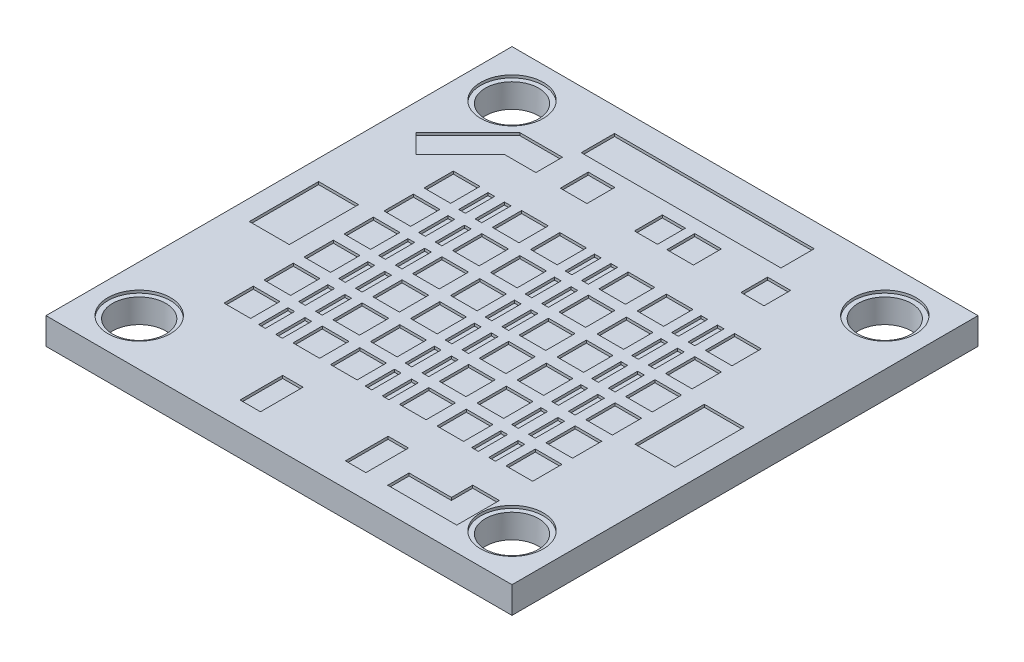
from build123d import *

# Parameters (mm, degrees)
SKETCH1_W          = 35
SKETCH1_H          = 35
SKETCH1_R          = 2
BASE_FLANGE2_DEPTH = 2
SKETCH2_W          = 15
SKETCH2_H          = 2.5
SKETCH2_W_2        = 2
SKETCH2_H_2        = 2.096279763
SKETCH2_H_3        = 2.2
SKETCH2_W_3        = 0.5
SKETCH2_W_4        = 1.534105798
SKETCH2_H_4        = 3.2
SKETCH2_W_5        = 3
SKETCH2_H_5        = 5.199999931
SKETCH2_W_6        = 1.731882906
SKETCH2_H_6        = 2
SKETCH2_R          = 2.35
SKETCH2_R_2        = 2
CUT_EXTRUDE1_DEPTH = 0.2


# Sheet-metal steps are written as plain solids
with BuildPart() as part:
    # Sketch1 → Base-Flange2 (new body)
    with BuildSketch(Plane(origin=(0, 0, 0), x_dir=(1, 0, 0), z_dir=(0, 1, 0))):
        Rectangle(SKETCH1_W, SKETCH1_H)
        with Locations(Location((-14, -14, 0), (0, 0, 270))):
            Circle(SKETCH1_R, mode=Mode.SUBTRACT)
        with Locations(Location((14, -14, 0), (0, 0, 90))):
            Circle(SKETCH1_R, mode=Mode.SUBTRACT)
        with Locations(Location((14, 14, 0), (0, 0, 270))):
            Circle(SKETCH1_R, mode=Mode.SUBTRACT)
        with Locations(Location((-14, 14, 0), (0, 0, 90))):
            Circle(SKETCH1_R, mode=Mode.SUBTRACT)
    extrude(amount=-BASE_FLANGE2_DEPTH)

    # Sketch2 → Cut-Extrude1 (cut)
    # profile 1 of 87: a face of its own
    with BuildSketch(Plane(origin=(0, 0, 0), x_dir=(1, 0, 0), z_dir=(0, 1, 0))):
        with Locations((-0.5, 14.45)):
            Rectangle(SKETCH2_W, SKETCH2_H)
    # profile 2 of 87: a face of its own
    with BuildSketch(Plane(origin=(0, 0, 0), x_dir=(1, 0, 0), z_dir=(0, 1, 0))):
        with Locations((-5.47579291, 11.151860119)):
            Rectangle(SKETCH2_W_2, SKETCH2_H_2)
    # profile 3 of 87: a face of its own
    with BuildSketch(Plane(origin=(0, 0, 0), x_dir=(1, 0, 0), z_dir=(0, 1, 0))):
        with Locations((-2.607675816, 6.1)):
            Rectangle(SKETCH2_W_2, SKETCH2_H_3)
    # profile 4 of 87: a face of its own
    with BuildSketch(Plane(origin=(0, 0, 0), x_dir=(1, 0, 0), z_dir=(0, 1, 0))):
        with Locations((-10.607675816, 6.1)):
            Rectangle(SKETCH2_W_2, SKETCH2_H_3)
    # profile 5 of 87: a face of its own
    with BuildSketch(Plane(origin=(0, 0, 0), x_dir=(1, 0, 0), z_dir=(0, 1, 0))):
        with Locations((-8.657675816, 6.003720444)):
            Rectangle(SKETCH2_W_3, SKETCH2_H_3)
    # profile 6 of 87: a face of its own
    with BuildSketch(Plane(origin=(0, 0, 0), x_dir=(1, 0, 0), z_dir=(0, 1, 0))):
        with Locations((-0.657675816, 6.003720444)):
            Rectangle(SKETCH2_W_3, SKETCH2_H_3)
    # profile 7 of 87: a face of its own
    with BuildSketch(Plane(origin=(0, 0, 0), x_dir=(1, 0, 0), z_dir=(0, 1, 0))):
        with Locations((5.392324184, 6.1)):
            Rectangle(SKETCH2_W_2, SKETCH2_H_3)
    # profile 8 of 87: a face of its own
    with BuildSketch(Plane(origin=(0, 0, 0), x_dir=(1, 0, 0), z_dir=(0, 1, 0))):
        with Locations((7.342324184, 6.003720444)):
            Rectangle(SKETCH2_W_3, SKETCH2_H_3)
    # profile 9 of 87: a face of its own
    with BuildSketch(Plane(origin=(0, 0, 0), x_dir=(1, 0, 0), z_dir=(0, 1, 0))):
        with Locations((-2.612819574, 3.100000069)):
            Rectangle(SKETCH2_W_2, SKETCH2_H_3)
    # profile 10 of 87: a face of its own
    with BuildSketch(Plane(origin=(0, 0, 0), x_dir=(1, 0, 0), z_dir=(0, 1, 0))):
        with Locations((-0.662819574, 3.003720513)):
            Rectangle(SKETCH2_W_3, SKETCH2_H_3)
    # profile 11 of 87: a face of its own
    with BuildSketch(Plane(origin=(0, 0, 0), x_dir=(1, 0, 0), z_dir=(0, 1, 0))):
        with Locations((5.387180426, 3.100000069)):
            Rectangle(SKETCH2_W_2, SKETCH2_H_3)
    # profile 12 of 87: a face of its own
    with BuildSketch(Plane(origin=(0, 0, 0), x_dir=(1, 0, 0), z_dir=(0, 1, 0))):
        with Locations((7.337180426, 3.003720513)):
            Rectangle(SKETCH2_W_3, SKETCH2_H_3)
    # profile 13 of 87: a face of its own
    with BuildSketch(Plane(origin=(0, 0, 0), x_dir=(1, 0, 0), z_dir=(0, 1, 0))):
        with Locations((-2.617963333, 0.100000138)):
            Rectangle(SKETCH2_W_2, SKETCH2_H_3)
    # profile 14 of 87: a face of its own
    with BuildSketch(Plane(origin=(0, 0, 0), x_dir=(1, 0, 0), z_dir=(0, 1, 0))):
        with Locations((-0.667963333, 0.003720582)):
            Rectangle(SKETCH2_W_3, SKETCH2_H_3)
    # profile 15 of 87: a face of its own
    with BuildSketch(Plane(origin=(0, 0, 0), x_dir=(1, 0, 0), z_dir=(0, 1, 0))):
        with Locations((5.382036667, 0.100000138)):
            Rectangle(SKETCH2_W_2, SKETCH2_H_3)
    # profile 16 of 87: a face of its own
    with BuildSketch(Plane(origin=(0, 0, 0), x_dir=(1, 0, 0), z_dir=(0, 1, 0))):
        with Locations((7.332036667, 0.003720582)):
            Rectangle(SKETCH2_W_3, SKETCH2_H_3)
    # profile 17 of 87: a face of its own
    with BuildSketch(Plane(origin=(0, 0, 0), x_dir=(1, 0, 0), z_dir=(0, 1, 0))):
        with Locations((-2.623107091, -2.899999793)):
            Rectangle(SKETCH2_W_2, SKETCH2_H_3)
    # profile 18 of 87: a face of its own
    with BuildSketch(Plane(origin=(0, 0, 0), x_dir=(1, 0, 0), z_dir=(0, 1, 0))):
        with Locations((-0.673107091, -2.996279349)):
            Rectangle(SKETCH2_W_3, SKETCH2_H_3)
    # profile 19 of 87: a face of its own
    with BuildSketch(Plane(origin=(0, 0, 0), x_dir=(1, 0, 0), z_dir=(0, 1, 0))):
        with Locations((5.376892909, -2.899999793)):
            Rectangle(SKETCH2_W_2, SKETCH2_H_3)
    # profile 20 of 87: a face of its own
    with BuildSketch(Plane(origin=(0, 0, 0), x_dir=(1, 0, 0), z_dir=(0, 1, 0))):
        with Locations((7.326892909, -2.996279349)):
            Rectangle(SKETCH2_W_3, SKETCH2_H_3)
    # profile 21 of 87: a face of its own
    with BuildSketch(Plane(origin=(0, 0, 0), x_dir=(1, 0, 0), z_dir=(0, 1, 0))):
        with Locations((-2.628250849, -5.899999724)):
            Rectangle(SKETCH2_W_2, SKETCH2_H_3)
    # profile 22 of 87: a face of its own
    with BuildSketch(Plane(origin=(0, 0, 0), x_dir=(1, 0, 0), z_dir=(0, 1, 0))):
        with Locations((-0.678250849, -5.99627928)):
            Rectangle(SKETCH2_W_3, SKETCH2_H_3)
    # profile 23 of 87: a face of its own
    with BuildSketch(Plane(origin=(0, 0, 0), x_dir=(1, 0, 0), z_dir=(0, 1, 0))):
        with Locations((5.371749151, -5.899999724)):
            Rectangle(SKETCH2_W_2, SKETCH2_H_3)
    # profile 24 of 87: a face of its own
    with BuildSketch(Plane(origin=(0, 0, 0), x_dir=(1, 0, 0), z_dir=(0, 1, 0))):
        with Locations((7.321749151, -5.99627928)):
            Rectangle(SKETCH2_W_3, SKETCH2_H_3)
    # profile 25 of 87: a face of its own
    with BuildSketch(Plane(origin=(0, 0, 0), x_dir=(1, 0, 0), z_dir=(0, 1, 0))):
        with Locations((-2.633394608, -8.899999656)):
            Rectangle(SKETCH2_W_2, SKETCH2_H_3)
    # profile 26 of 87: a face of its own
    with BuildSketch(Plane(origin=(0, 0, 0), x_dir=(1, 0, 0), z_dir=(0, 1, 0))):
        with Locations((-0.683394608, -8.996279212)):
            Rectangle(SKETCH2_W_3, SKETCH2_H_3)
    # profile 27 of 87: a face of its own
    with BuildSketch(Plane(origin=(0, 0, 0), x_dir=(1, 0, 0), z_dir=(0, 1, 0))):
        with Locations((5.366605392, -8.899999656)):
            Rectangle(SKETCH2_W_2, SKETCH2_H_3)
    # profile 28 of 87: a face of its own
    with BuildSketch(Plane(origin=(0, 0, 0), x_dir=(1, 0, 0), z_dir=(0, 1, 0))):
        with Locations((7.316605392, -8.996279212)):
            Rectangle(SKETCH2_W_3, SKETCH2_H_3)
    # profile 29 of 87: a face of its own
    with BuildSketch(Plane(origin=(0, 0, 0), x_dir=(1, 0, 0), z_dir=(0, 1, 0))):
        with Locations((-10.612819574, 3.100000069)):
            Rectangle(SKETCH2_W_2, SKETCH2_H_3)
    # profile 30 of 87: a face of its own
    with BuildSketch(Plane(origin=(0, 0, 0), x_dir=(1, 0, 0), z_dir=(0, 1, 0))):
        with Locations((-8.662819574, 3.003720513)):
            Rectangle(SKETCH2_W_3, SKETCH2_H_3)
    # profile 31 of 87: a face of its own
    with BuildSketch(Plane(origin=(0, 0, 0), x_dir=(1, 0, 0), z_dir=(0, 1, 0))):
        with Locations((-10.617963333, 0.100000138)):
            Rectangle(SKETCH2_W_2, SKETCH2_H_3)
    # profile 32 of 87: a face of its own
    with BuildSketch(Plane(origin=(0, 0, 0), x_dir=(1, 0, 0), z_dir=(0, 1, 0))):
        with Locations((-8.667963333, 0.003720582)):
            Rectangle(SKETCH2_W_3, SKETCH2_H_3)
    # profile 33 of 87: a face of its own
    with BuildSketch(Plane(origin=(0, 0, 0), x_dir=(1, 0, 0), z_dir=(0, 1, 0))):
        with Locations((-10.623107091, -2.899999793)):
            Rectangle(SKETCH2_W_2, SKETCH2_H_3)
    # profile 34 of 87: a face of its own
    with BuildSketch(Plane(origin=(0, 0, 0), x_dir=(1, 0, 0), z_dir=(0, 1, 0))):
        with Locations((-8.673107091, -2.996279349)):
            Rectangle(SKETCH2_W_3, SKETCH2_H_3)
    # profile 35 of 87: a face of its own
    with BuildSketch(Plane(origin=(0, 0, 0), x_dir=(1, 0, 0), z_dir=(0, 1, 0))):
        with Locations((-10.628250849, -5.899999724)):
            Rectangle(SKETCH2_W_2, SKETCH2_H_3)
    # profile 36 of 87: a face of its own
    with BuildSketch(Plane(origin=(0, 0, 0), x_dir=(1, 0, 0), z_dir=(0, 1, 0))):
        with Locations((-8.678250849, -5.99627928)):
            Rectangle(SKETCH2_W_3, SKETCH2_H_3)
    # profile 37 of 87: a face of its own
    with BuildSketch(Plane(origin=(0, 0, 0), x_dir=(1, 0, 0), z_dir=(0, 1, 0))):
        with Locations((-10.633394608, -8.899999656)):
            Rectangle(SKETCH2_W_2, SKETCH2_H_3)
    # profile 38 of 87: a face of its own
    with BuildSketch(Plane(origin=(0, 0, 0), x_dir=(1, 0, 0), z_dir=(0, 1, 0))):
        with Locations((-8.683394608, -8.996279212)):
            Rectangle(SKETCH2_W_3, SKETCH2_H_3)
    # profile 39 of 87: a face of its own
    with BuildSketch(Plane(origin=(0, 0, 0), x_dir=(1, 0, 0), z_dir=(0, 1, 0))):
        with Locations((-7.400074118, -8.996279212)):
            Rectangle(SKETCH2_W_3, SKETCH2_H_3)
    # profile 40 of 87: a face of its own
    with BuildSketch(Plane(origin=(0, 0, 0), x_dir=(1, 0, 0), z_dir=(0, 1, 0))):
        with Locations((-5.450074118, -8.899999656)):
            Rectangle(SKETCH2_W_2, SKETCH2_H_3)
    # profile 41 of 87: a face of its own
    with BuildSketch(Plane(origin=(0, 0, 0), x_dir=(1, 0, 0), z_dir=(0, 1, 0))):
        with Locations((-7.405217877, -5.99627928)):
            Rectangle(SKETCH2_W_3, SKETCH2_H_3)
    # profile 42 of 87: a face of its own
    with BuildSketch(Plane(origin=(0, 0, 0), x_dir=(1, 0, 0), z_dir=(0, 1, 0))):
        with Locations((-5.455217877, -5.899999724)):
            Rectangle(SKETCH2_W_2, SKETCH2_H_3)
    # profile 43 of 87: a face of its own
    with BuildSketch(Plane(origin=(0, 0, 0), x_dir=(1, 0, 0), z_dir=(0, 1, 0))):
        with Locations((-7.410361635, -2.996279349)):
            Rectangle(SKETCH2_W_3, SKETCH2_H_3)
    # profile 44 of 87: a face of its own
    with BuildSketch(Plane(origin=(0, 0, 0), x_dir=(1, 0, 0), z_dir=(0, 1, 0))):
        with Locations((-5.460361635, -2.899999793)):
            Rectangle(SKETCH2_W_2, SKETCH2_H_3)
    # profile 45 of 87: a face of its own
    with BuildSketch(Plane(origin=(0, 0, 0), x_dir=(1, 0, 0), z_dir=(0, 1, 0))):
        with Locations((-7.415505394, 0.003720582)):
            Rectangle(SKETCH2_W_3, SKETCH2_H_3)
    # profile 46 of 87: a face of its own
    with BuildSketch(Plane(origin=(0, 0, 0), x_dir=(1, 0, 0), z_dir=(0, 1, 0))):
        with Locations((-5.465505394, 0.100000138)):
            Rectangle(SKETCH2_W_2, SKETCH2_H_3)
    # profile 47 of 87: a face of its own
    with BuildSketch(Plane(origin=(0, 0, 0), x_dir=(1, 0, 0), z_dir=(0, 1, 0))):
        with Locations((-7.420649152, 3.003720513)):
            Rectangle(SKETCH2_W_3, SKETCH2_H_3)
    # profile 48 of 87: a face of its own
    with BuildSketch(Plane(origin=(0, 0, 0), x_dir=(1, 0, 0), z_dir=(0, 1, 0))):
        with Locations((-5.470649152, 3.100000069)):
            Rectangle(SKETCH2_W_2, SKETCH2_H_3)
    # profile 49 of 87: a face of its own
    with BuildSketch(Plane(origin=(0, 0, 0), x_dir=(1, 0, 0), z_dir=(0, 1, 0))):
        with Locations((-7.42579291, 6.003720444)):
            Rectangle(SKETCH2_W_3, SKETCH2_H_3)
    # profile 50 of 87: a face of its own
    with BuildSketch(Plane(origin=(0, 0, 0), x_dir=(1, 0, 0), z_dir=(0, 1, 0))):
        with Locations((-5.47579291, 6.1)):
            Rectangle(SKETCH2_W_2, SKETCH2_H_3)
    # profile 51 of 87: a face of its own
    with BuildSketch(Plane(origin=(0, 0, 0), x_dir=(1, 0, 0), z_dir=(0, 1, 0))):
        with Locations((2.52420709, 6.1)):
            Rectangle(SKETCH2_W_2, SKETCH2_H_3)
    # profile 52 of 87: a face of its own
    with BuildSketch(Plane(origin=(0, 0, 0), x_dir=(1, 0, 0), z_dir=(0, 1, 0))):
        with Locations((0.57420709, 6.003720444)):
            Rectangle(SKETCH2_W_3, SKETCH2_H_3)
    # profile 53 of 87: a face of its own
    with BuildSketch(Plane(origin=(0, 0, 0), x_dir=(1, 0, 0), z_dir=(0, 1, 0))):
        with Locations((2.529350848, 3.100000069)):
            Rectangle(SKETCH2_W_2, SKETCH2_H_3)
    # profile 54 of 87: a face of its own
    with BuildSketch(Plane(origin=(0, 0, 0), x_dir=(1, 0, 0), z_dir=(0, 1, 0))):
        with Locations((0.579350848, 3.003720513)):
            Rectangle(SKETCH2_W_3, SKETCH2_H_3)
    # profile 55 of 87: a face of its own
    with BuildSketch(Plane(origin=(0, 0, 0), x_dir=(1, 0, 0), z_dir=(0, 1, 0))):
        with Locations((2.534494606, 0.100000138)):
            Rectangle(SKETCH2_W_2, SKETCH2_H_3)
    # profile 56 of 87: a face of its own
    with BuildSketch(Plane(origin=(0, 0, 0), x_dir=(1, 0, 0), z_dir=(0, 1, 0))):
        with Locations((0.584494606, 0.003720582)):
            Rectangle(SKETCH2_W_3, SKETCH2_H_3)
    # profile 57 of 87: a face of its own
    with BuildSketch(Plane(origin=(0, 0, 0), x_dir=(1, 0, 0), z_dir=(0, 1, 0))):
        with Locations((2.539638365, -2.899999793)):
            Rectangle(SKETCH2_W_2, SKETCH2_H_3)
    # profile 58 of 87: a face of its own
    with BuildSketch(Plane(origin=(0, 0, 0), x_dir=(1, 0, 0), z_dir=(0, 1, 0))):
        with Locations((0.589638365, -2.996279349)):
            Rectangle(SKETCH2_W_3, SKETCH2_H_3)
    # profile 59 of 87: a face of its own
    with BuildSketch(Plane(origin=(0, 0, 0), x_dir=(1, 0, 0), z_dir=(0, 1, 0))):
        with Locations((2.544782123, -5.899999724)):
            Rectangle(SKETCH2_W_2, SKETCH2_H_3)
    # profile 60 of 87: a face of its own
    with BuildSketch(Plane(origin=(0, 0, 0), x_dir=(1, 0, 0), z_dir=(0, 1, 0))):
        with Locations((0.594782123, -5.99627928)):
            Rectangle(SKETCH2_W_3, SKETCH2_H_3)
    # profile 61 of 87: a face of its own
    with BuildSketch(Plane(origin=(0, 0, 0), x_dir=(1, 0, 0), z_dir=(0, 1, 0))):
        with Locations((2.549925882, -8.899999656)):
            Rectangle(SKETCH2_W_2, SKETCH2_H_3)
    # profile 62 of 87: a face of its own
    with BuildSketch(Plane(origin=(0, 0, 0), x_dir=(1, 0, 0), z_dir=(0, 1, 0))):
        with Locations((0.599925882, -8.996279212)):
            Rectangle(SKETCH2_W_3, SKETCH2_H_3)
    # profile 63 of 87: a face of its own
    with BuildSketch(Plane(origin=(0, 0, 0), x_dir=(1, 0, 0), z_dir=(0, 1, 0))):
        with Locations((10.52420709, 6.1)):
            Rectangle(SKETCH2_W_2, SKETCH2_H_3)
    # profile 64 of 87: a face of its own
    with BuildSketch(Plane(origin=(0, 0, 0), x_dir=(1, 0, 0), z_dir=(0, 1, 0))):
        with Locations((8.57420709, 6.003720444)):
            Rectangle(SKETCH2_W_3, SKETCH2_H_3)
    # profile 65 of 87: a face of its own
    with BuildSketch(Plane(origin=(0, 0, 0), x_dir=(1, 0, 0), z_dir=(0, 1, 0))):
        with Locations((10.529350848, 3.100000069)):
            Rectangle(SKETCH2_W_2, SKETCH2_H_3)
    # profile 66 of 87: a face of its own
    with BuildSketch(Plane(origin=(0, 0, 0), x_dir=(1, 0, 0), z_dir=(0, 1, 0))):
        with Locations((8.579350848, 3.003720513)):
            Rectangle(SKETCH2_W_3, SKETCH2_H_3)
    # profile 67 of 87: a face of its own
    with BuildSketch(Plane(origin=(0, 0, 0), x_dir=(1, 0, 0), z_dir=(0, 1, 0))):
        with Locations((10.534494606, 0.100000138)):
            Rectangle(SKETCH2_W_2, SKETCH2_H_3)
    # profile 68 of 87: a face of its own
    with BuildSketch(Plane(origin=(0, 0, 0), x_dir=(1, 0, 0), z_dir=(0, 1, 0))):
        with Locations((8.584494606, 0.003720582)):
            Rectangle(SKETCH2_W_3, SKETCH2_H_3)
    # profile 69 of 87: a face of its own
    with BuildSketch(Plane(origin=(0, 0, 0), x_dir=(1, 0, 0), z_dir=(0, 1, 0))):
        with Locations((10.539638365, -2.899999793)):
            Rectangle(SKETCH2_W_2, SKETCH2_H_3)
    # profile 70 of 87: a face of its own
    with BuildSketch(Plane(origin=(0, 0, 0), x_dir=(1, 0, 0), z_dir=(0, 1, 0))):
        with Locations((8.589638365, -2.996279349)):
            Rectangle(SKETCH2_W_3, SKETCH2_H_3)
    # profile 71 of 87: a face of its own
    with BuildSketch(Plane(origin=(0, 0, 0), x_dir=(1, 0, 0), z_dir=(0, 1, 0))):
        with Locations((10.544782123, -5.899999724)):
            Rectangle(SKETCH2_W_2, SKETCH2_H_3)
    # profile 72 of 87: a face of its own
    with BuildSketch(Plane(origin=(0, 0, 0), x_dir=(1, 0, 0), z_dir=(0, 1, 0))):
        with Locations((8.594782123, -5.99627928)):
            Rectangle(SKETCH2_W_3, SKETCH2_H_3)
    # profile 73 of 87: a face of its own
    with BuildSketch(Plane(origin=(0, 0, 0), x_dir=(1, 0, 0), z_dir=(0, 1, 0))):
        with Locations((10.549925882, -8.899999656)):
            Rectangle(SKETCH2_W_2, SKETCH2_H_3)
    # profile 74 of 87: a face of its own
    with BuildSketch(Plane(origin=(0, 0, 0), x_dir=(1, 0, 0), z_dir=(0, 1, 0))):
        with Locations((8.599925882, -8.996279212)):
            Rectangle(SKETCH2_W_3, SKETCH2_H_3)
    # profile 75 of 87: a face of its own
    with BuildSketch(Plane(origin=(0, 0, 0), x_dir=(1, 0, 0), z_dir=(0, 1, 0))):
        with Locations((-3.958265637, -14.1)):
            Rectangle(SKETCH2_W_4, SKETCH2_H_4)
    # profile 76 of 87: a face of its own
    with BuildSketch(Plane(origin=(0, 0, 0), x_dir=(1, 0, 0), z_dir=(0, 1, 0))):
        with Locations((3.958265637, -14.1)):
            Rectangle(SKETCH2_W_4, SKETCH2_H_4)
    # profile 77 of 87: a face of its own
    with BuildSketch(Plane(origin=(0, 0, 0), x_dir=(1, 0, 0), z_dir=(0, 1, 0))):
        with Locations((-14.484241404, -1.142559354)):
            Rectangle(SKETCH2_W_5, SKETCH2_H_5)
    # profile 78 of 87: a face of its own
    with BuildSketch(Plane(origin=(0, 0, 0), x_dir=(1, 0, 0), z_dir=(0, 1, 0))):
        with Locations((14.484241404, -1.142559354)):
            Rectangle(SKETCH2_W_5, SKETCH2_H_5)
    # profile 79 of 87: a face of its own
    with BuildSketch(Plane(origin=(0, 0, 0), x_dir=(1, 0, 0), z_dir=(0, 1, 0))):
        with Locations((-0.041734363, 11.151860119)):
            Rectangle(SKETCH2_W_6, SKETCH2_H_2)
    # profile 80 of 87: a face of its own
    with BuildSketch(Plane(origin=(0, 0, 0), x_dir=(1, 0, 0), z_dir=(0, 1, 0))):
        with Locations((2.52420709, 11.151860119)):
            Rectangle(SKETCH2_W_2, SKETCH2_H_2)
    # profile 81 of 87: a face of its own
    with BuildSketch(Plane(origin=(0, 0, 0), x_dir=(1, 0, 0), z_dir=(0, 1, 0))):
        Polygon((9.549925882, -14.1), (6.366605392, -14.1), (6.366605392, -15.7), (11.549925882, -15.7), (11.549925882, -12.5), (9.549925882, -12.5), align=None)
    # profile 82 of 87: a face of its own
    with BuildSketch(Plane(origin=(0, 0, 0), x_dir=(1, 0, 0), z_dir=(0, 1, 0))):
        with Locations((7.958265637, 11.103720237)):
            Rectangle(SKETCH2_W_6, SKETCH2_H_6)
    # profile 83 of 87: a face of its own
    with BuildSketch(Plane(origin=(0, 0, 0), x_dir=(1, 0, 0), z_dir=(0, 1, 0))):
        Polygon((-10.779248691, 10.2), (-8.407675816, 10.2), (-8.407675816, 12.2), (-11.607675816, 12.2), (-15.514169512, 8.293506304), (-14.099955949, 6.879292742), align=None)
    # profile 84 of 87: a face of its own
    with BuildSketch(Plane(origin=(0, 0, 0), x_dir=(1, 0, 0), z_dir=(0, 1, 0))):
        with Locations(Location((-14, 14, 0), (0, 0, 270))):
            Circle(SKETCH2_R)
        with Locations(Location((-14, 14, 0), (0, 0, 270))):
            Circle(SKETCH2_R_2, mode=Mode.SUBTRACT)
    # profile 85 of 87: a face of its own
    with BuildSketch(Plane(origin=(0, 0, 0), x_dir=(1, 0, 0), z_dir=(0, 1, 0))):
        with Locations(Location((-14, -14, 0), (0, 0, 270))):
            Circle(SKETCH2_R)
        with Locations(Location((-14, -14, 0), (0, 0, 270))):
            Circle(SKETCH2_R_2, mode=Mode.SUBTRACT)
    # profile 86 of 87: a face of its own
    with BuildSketch(Plane(origin=(0, 0, 0), x_dir=(1, 0, 0), z_dir=(0, 1, 0))):
        with Locations(Location((14, -14, 0), (0, 0, 270))):
            Circle(SKETCH2_R)
        with Locations(Location((14, -14, 0), (0, 0, 270))):
            Circle(SKETCH2_R_2, mode=Mode.SUBTRACT)
    # profile 87 of 87: a face of its own
    with BuildSketch(Plane(origin=(0, 0, 0), x_dir=(1, 0, 0), z_dir=(0, 1, 0))):
        with Locations(Location((14, 14, 0), (0, 0, 270))):
            Circle(SKETCH2_R)
        with Locations(Location((14, 14, 0), (0, 0, 270))):
            Circle(SKETCH2_R_2, mode=Mode.SUBTRACT)
    extrude(amount=-CUT_EXTRUDE1_DEPTH, mode=Mode.SUBTRACT)


solid = part.part
